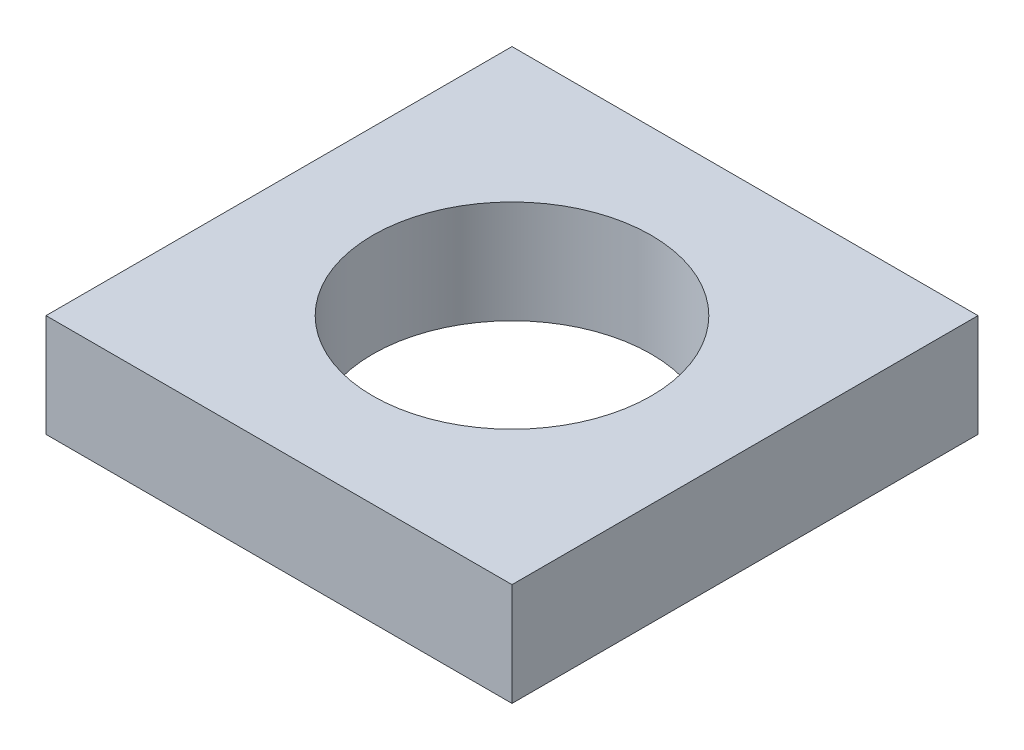
from build123d import *

# Parameters (mm, degrees)
SKETCH1_W           = 9.779
SKETCH1_H           = 9.779
BOSS_EXTRUDE1_DEPTH = 2.159
SKETCH2_R           = 2.921
CUT_EXTRUDE1_DEPTH  = 8.244011423


with BuildPart() as part:
    # Sketch1 → Boss-Extrude1 (new body)
    with BuildSketch(Plane(origin=(0, 0, 0), x_dir=(1, 0, 0), z_dir=(0, 1, 0))):
        Rectangle(SKETCH1_W, SKETCH1_H)
    extrude(amount=BOSS_EXTRUDE1_DEPTH)

    # Sketch2 → Cut-Extrude1 (cut, through all)
    with BuildSketch(Plane(origin=(0, 2.159, 0), x_dir=(1, 0, 0), z_dir=(0, 1, 0))):
        Circle(SKETCH2_R)
    extrude(amount=-CUT_EXTRUDE1_DEPTH, mode=Mode.SUBTRACT)


solid = part.part
